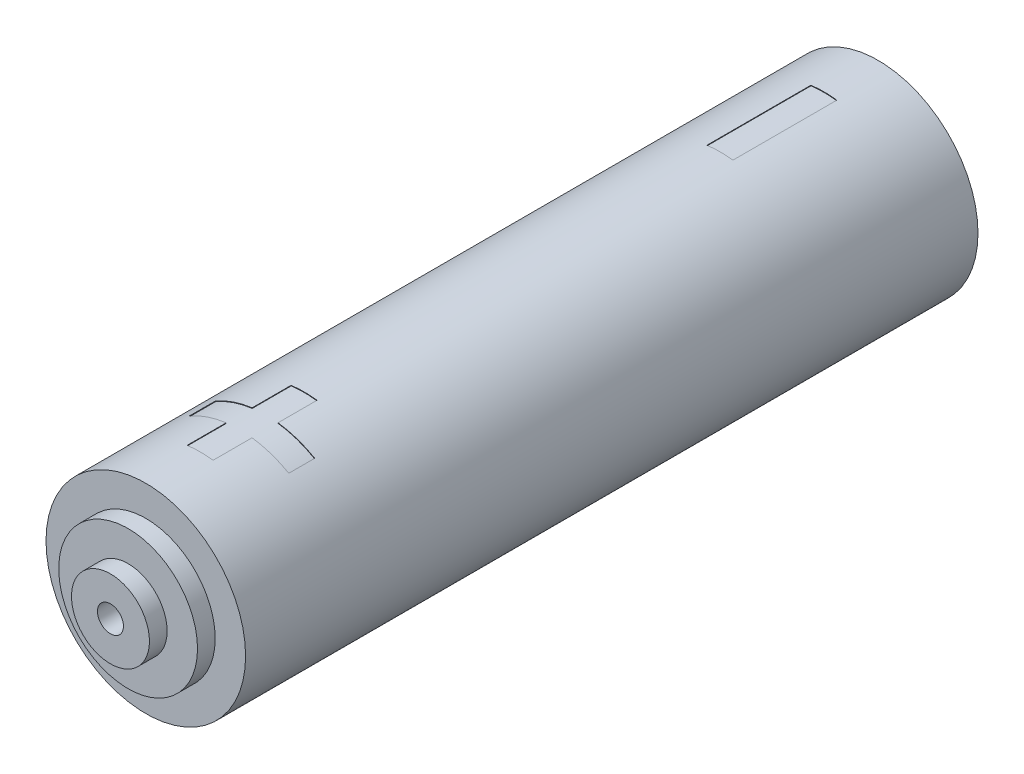
from build123d import *

# Parameters (mm, degrees)
OTW_R_GWINTOWANY_M61_D      = 5
OTW_R_GWINTOWANY_M61_DEPTH  = 7
OTW_R_GWINTOWANY_M61_TIP    = 1.502151548
OTW_R_GWINTOWANY_M62_D      = 5
OTW_R_GWINTOWANY_M62_DEPTH  = 7
OTW_R_GWINTOWANY_M62_TIP    = 1.502151548
ZAWIJAJ1_SECTION_W          = 0.1
ZAWIJAJ1_SECTION_H          = 7.5
ZAWIJAJ1_ANGLE              = 14.920775915
ZAWIJAJ1_SECTOR_2_SECTION_W = 0.1
ZAWIJAJ1_SECTOR_2_SECTION_H = 5
ZAWIJAJ1_SECTOR_2_ANGLE     = 59.683103659
ZAWIJAJ1_SECTOR_3_SECTION_W = 0.1
ZAWIJAJ1_SECTOR_3_SECTION_H = 7.5
ZAWIJAJ1_SECTOR_3_ANGLE     = 14.920775915
ZAWIJAJ1_SECTOR_4_SECTION_W = 0.1
ZAWIJAJ1_SECTOR_4_SECTION_H = 20
ZAWIJAJ1_SECTOR_4_ANGLE     = 14.920775915


with BuildPart() as part:
    # Szkic1 → Obrót1 (revolve)
    with BuildSketch(Plane(origin=(0, 0, 0), x_dir=(0, 0, -1), z_dir=(1, 0, 0))):
        Polygon((-77.25, 0), (-77.25, 7.5), (-73.85, 7.5), (-73.85, 13.35), (-70.45, 13.35), (-70.45, 19.2), (70.45, 19.2), (70.45, 7.5), (77.25, 7.5), (77.25, 0), align=None)
    revolve(axis=Axis((0, 0, 77.25), (0, 0, -1)))

    # Otwór gwintowany M61
    with Locations(Plane.XY.offset(77.25)):
        with Locations((0, 0)):
            Hole(OTW_R_GWINTOWANY_M61_D / 2, depth=OTW_R_GWINTOWANY_M61_DEPTH)
            with Locations((0, 0, -(OTW_R_GWINTOWANY_M61_DEPTH + OTW_R_GWINTOWANY_M61_TIP / 2))):  # 118° drill point
                Cone(0, OTW_R_GWINTOWANY_M61_D / 2, OTW_R_GWINTOWANY_M61_TIP, mode=Mode.SUBTRACT)

    # Otwór gwintowany M62
    with Locations(Plane(origin=(0, 0, -77.25), x_dir=(-1, 0, 0), z_dir=(0, 0, -1))):
        with Locations((0, 0)):
            Hole(OTW_R_GWINTOWANY_M62_D / 2, depth=OTW_R_GWINTOWANY_M62_DEPTH)
            with Locations((0, 0, -(OTW_R_GWINTOWANY_M62_DEPTH + OTW_R_GWINTOWANY_M62_TIP / 2))):  # 118° drill point
                Cone(0, OTW_R_GWINTOWANY_M62_D / 2, OTW_R_GWINTOWANY_M62_TIP, mode=Mode.SUBTRACT)

    # Zawijaj1 section (on wrap section) → Zawijaj1 (revolve, cut)
    with BuildSketch(Plane(origin=(0, 0, 70.45), x_dir=(-0.12984071519948315, 0.9915348650836675, 0), z_dir=(-0.9915348650836675, -0.12984071519948315, 0))):
        with Locations((19.15, 14.2)):
            Rectangle(ZAWIJAJ1_SECTION_W, ZAWIJAJ1_SECTION_H)
    revolve(axis=Axis((0, 0, 70.45), (0, 0, -1)), revolution_arc=ZAWIJAJ1_ANGLE, mode=Mode.SUBTRACT)

    # Zawijaj1 sector 2 section (on wrap section) → Zawijaj1 sector 2 (revolve, cut)
    with BuildSketch(Plane(origin=(0, 0, 70.45), x_dir=(-0.4976031478819505, 0.8674048116179514, 0), z_dir=(-0.8674048116179514, -0.4976031478819505, 0))):
        with Locations((19.15, 20.45)):
            Rectangle(ZAWIJAJ1_SECTOR_2_SECTION_W, ZAWIJAJ1_SECTOR_2_SECTION_H)
    revolve(axis=Axis((0, 0, 70.45), (0, 0, -1)), revolution_arc=ZAWIJAJ1_SECTOR_2_ANGLE, mode=Mode.SUBTRACT)

    # Zawijaj1 sector 3 section (on wrap section) → Zawijaj1 sector 3 (revolve, cut)
    with BuildSketch(Plane(origin=(0, 0, 70.45), x_dir=(-0.12984071519948312, 0.9915348650836675, 0), z_dir=(-0.9915348650836675, -0.12984071519948312, 0))):
        with Locations((19.15, 26.7)):
            Rectangle(ZAWIJAJ1_SECTOR_3_SECTION_W, ZAWIJAJ1_SECTOR_3_SECTION_H)
    revolve(axis=Axis((0, 0, 70.45), (0, 0, -1)), revolution_arc=ZAWIJAJ1_SECTOR_3_ANGLE, mode=Mode.SUBTRACT)

    # Zawijaj1 sector 4 section (on wrap section) → Zawijaj1 sector 4 (revolve, cut)
    with BuildSketch(Plane(origin=(0, 0, 70.45), x_dir=(-0.12984071519948348, 0.9915348650836675, 0), z_dir=(-0.9915348650836675, -0.12984071519948348, 0))):
        with Locations((19.15, 120.45)):
            Rectangle(ZAWIJAJ1_SECTOR_4_SECTION_W, ZAWIJAJ1_SECTOR_4_SECTION_H)
    revolve(axis=Axis((0, 0, 70.45), (0, 0, -1)), revolution_arc=ZAWIJAJ1_SECTOR_4_ANGLE, mode=Mode.SUBTRACT)


solid = part.part
